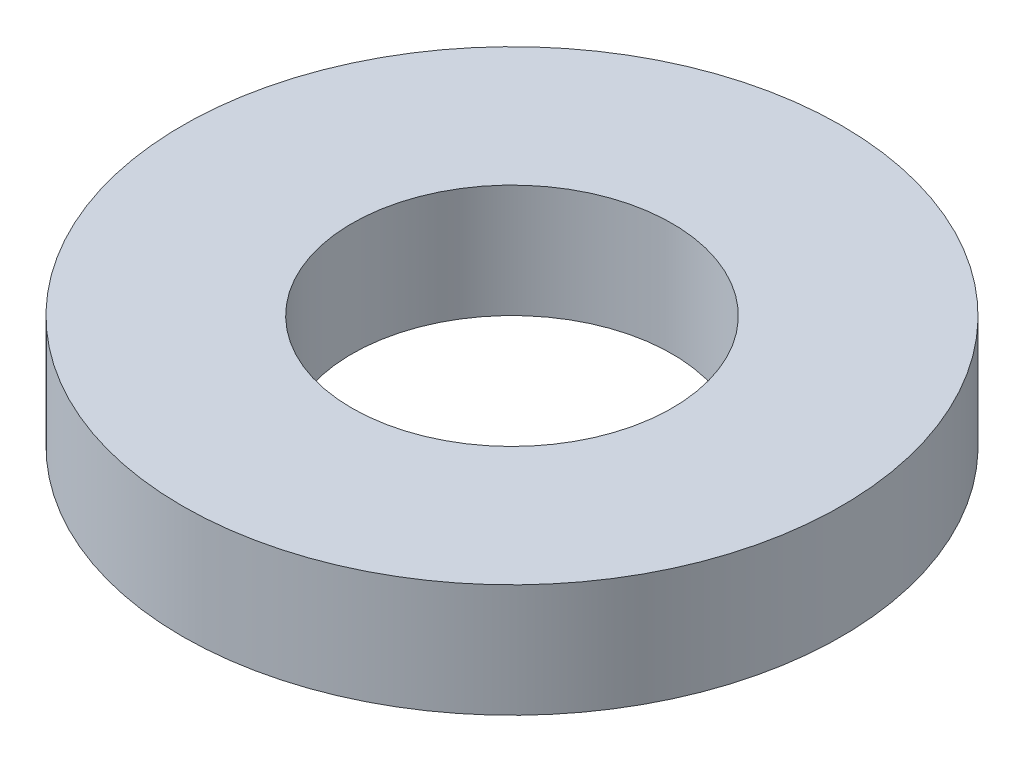
from build123d import *

# Parameters (mm, degrees)
SKETCH1_R           = 87.5
BOSS_EXTRUDE1_DEPTH = 30
SKETCH2_R           = 42.5
CUT_EXTRUDE1_DEPTH  = 128.328315782


with BuildPart() as part:
    # Sketch1 → Boss-Extrude1 (new body)
    with BuildSketch(Plane(origin=(0, 0, 0), x_dir=(1, 0, 0), z_dir=(0, 1, 0))):
        Circle(SKETCH1_R)
    extrude(amount=BOSS_EXTRUDE1_DEPTH)

    # Sketch2 → Cut-Extrude1 (cut, through all)
    with BuildSketch(Plane(origin=(0, 0, 0), x_dir=(1, 0, 0), z_dir=(0, 1, 0))):
        Circle(SKETCH2_R)
    extrude(amount=CUT_EXTRUDE1_DEPTH, mode=Mode.SUBTRACT)


solid = part.part
